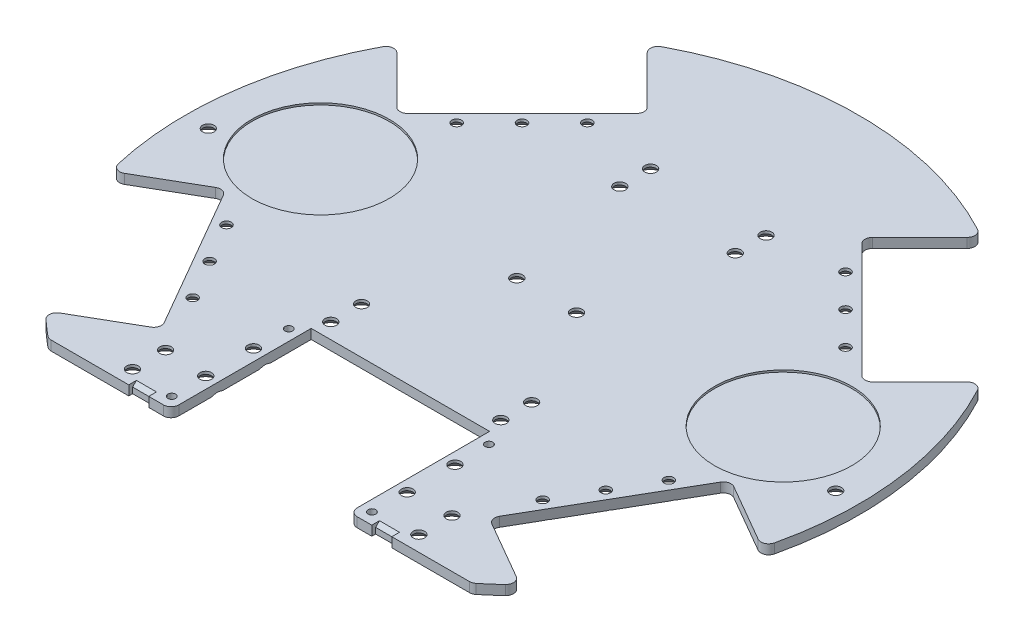
from build123d import *

# Parameters (mm, degrees)
RESSALTO_EXTRUS_O1_DEPTH = 2.5
CORTE_EXTRUS_O1_REACH    = 125.769
ESBO_O7_W                = 5.2
ESBO_O7_H                = 1
CHANFRO1_SIZE            = 1
ESBO_O10_R               = 1
ESBO_O10_R_2             = 1.25
ESBO_O10_R_3             = 1.5
CORTE_EXTRUS_O4_DEPTH    = 2.5
CHANFRO2_SIZE            = 1.8
ESBO_O11_R               = 17.85
CORTE_EXTRUS_O5_DEPTH    = 0.5


with BuildPart() as part:
    # Esboço3 → Ressalto-extrusão1 (new body)
    with BuildSketch(Plane(origin=(0, 0, 0), x_dir=(1, 0, 0), z_dir=(0, 1, 0))):
        with BuildLine():
            Line((-21.17, -31.6), (21.17, -31.6))
            Line((21.17, -31.6), (23.17, -31.6))
            Line((23.17, -31.6), (23.17, -33.6))
            Line((23.17, -33.6), (23.17, -66))
            ThreePointArc((23.17, -66), (23.755786438, -67.414213562), (25.17, -68))
            Line((25.17, -68), (54.353012796, -68))
            ThreePointArc((54.353012796, -68), (55.028394429, -67.882514183), (55.6244283, -67.543859649))
            ThreePointArc((55.6244283, -67.543859649), (57.676074894, -65.800610824), (59.673119561, -63.995068574))
            ThreePointArc((59.673119561, -63.995068574), (60.296309326, -62.30594469), (59.309162543, -60.800273342))
            Line((59.309162543, -60.800273342), (44.291990856, -52.130105226))
            ThreePointArc((44.291990856, -52.130105226), (43.360139203, -50.915692509), (43.559940048, -49.398054419))
            Line((43.559940048, -49.398054419), (64.559940048, -13.02498746))
            ThreePointArc((64.559940048, -13.02498746), (65.774352766, -12.093135807), (67.291990856, -12.292936652))
            Line((67.291990856, -12.292936652), (82.309162543, -20.963104768))
            ThreePointArc((82.309162543, -20.963104768), (84.106685572, -21.065163286), (85.257914883, -19.680903176))
            ThreePointArc((85.257914883, -19.680903176), (86.75142537, 11.421041819), (77.259029314, 41.07666478))
            ThreePointArc((77.259029314, 41.07666478), (75.78875431, 42.115797299), (74.078895082, 41.551983147))
            Line((74.078895082, 41.551983147), (61.817425744, 29.29051381))
            ThreePointArc((61.817425744, 29.29051381), (60.403212182, 28.704727372), (58.988998619, 29.29051381))
            Line((58.988998619, 29.29051381), (29.29051381, 58.988998619))
            ThreePointArc((29.29051381, 58.988998619), (28.704727372, 60.403212182), (29.29051381, 61.817425744))
            Line((29.29051381, 61.817425744), (41.551983147, 74.078895082))
            ThreePointArc((41.551983147, 74.078895082), (42.115797299, 75.78875431), (41.07666478, 77.259029314))
            ThreePointArc((41.07666478, 77.259029314), (0, 87.5), (-41.07666478, 77.259029314))
            ThreePointArc((-41.07666478, 77.259029314), (-42.115797299, 75.78875431), (-41.551983147, 74.078895082))
            Line((-41.551983147, 74.078895082), (-29.29051381, 61.817425744))
            ThreePointArc((-29.29051381, 61.817425744), (-28.704727372, 60.403212182), (-29.29051381, 58.988998619))
            Line((-29.29051381, 58.988998619), (-58.988998619, 29.29051381))
            ThreePointArc((-58.988998619, 29.29051381), (-60.403212182, 28.704727372), (-61.817425744, 29.29051381))
            Line((-61.817425744, 29.29051381), (-74.078895082, 41.551983147))
            ThreePointArc((-74.078895082, 41.551983147), (-75.78875431, 42.115797299), (-77.259029314, 41.07666478))
            ThreePointArc((-77.259029314, 41.07666478), (-86.75142537, 11.421041819), (-85.257914883, -19.680903176))
            ThreePointArc((-85.257914883, -19.680903176), (-84.106685572, -21.065163286), (-82.309162543, -20.963104768))
            Line((-82.309162543, -20.963104768), (-67.291990856, -12.292936652))
            ThreePointArc((-67.291990856, -12.292936652), (-65.774352766, -12.093135807), (-64.559940048, -13.02498746))
            Line((-64.559940048, -13.02498746), (-43.559940048, -49.398054419))
            ThreePointArc((-43.559940048, -49.398054419), (-43.360139203, -50.915692509), (-44.291990856, -52.130105226))
            Line((-44.291990856, -52.130105226), (-59.309162543, -60.800273342))
            ThreePointArc((-59.309162543, -60.800273342), (-60.296309326, -62.30594469), (-59.673119561, -63.995068574))
            ThreePointArc((-59.673119561, -63.995068574), (-57.676074894, -65.800610824), (-55.6244283, -67.543859649))
            ThreePointArc((-55.6244283, -67.543859649), (-55.028394429, -67.882514183), (-54.353012796, -68))
            Line((-54.353012796, -68), (-25.17, -68))
            ThreePointArc((-25.17, -68), (-23.755786438, -67.414213562), (-23.17, -66))
            Line((-23.17, -66), (-23.17, -33.6))
            Line((-23.17, -33.6), (-23.17, -31.6))
            Line((-23.17, -31.6), (-21.17, -31.6))
        make_face()
    extrude(amount=RESSALTO_EXTRUS_O1_DEPTH)

    # Esboço7 → Corte-extrusão1 (cut, up to next)
    with BuildSketch(Plane(origin=(0, 2.5, 0), x_dir=(1, 0, 0), z_dir=(0, 1, 0)), mode=Mode.PRIVATE) as corte_extrus_o1_sk1:
        with Locations((31.57, -67.5)):
            Rectangle(ESBO_O7_W, ESBO_O7_H)
    corte_extrus_o1_tool1 = extrude(corte_extrus_o1_sk1.sketch, amount=-CORTE_EXTRUS_O1_REACH, mode=Mode.PRIVATE) & part.part
    # Esboço7 → Corte-extrusão1 (cut, up to next)
    with BuildSketch(Plane(origin=(0, 2.5, 0), x_dir=(1, 0, 0), z_dir=(0, 1, 0)), mode=Mode.PRIVATE) as corte_extrus_o1_sk2:
        with Locations((-31.57, -67.5)):
            Rectangle(ESBO_O7_W, ESBO_O7_H)
    corte_extrus_o1_tool2 = extrude(corte_extrus_o1_sk2.sketch, amount=-CORTE_EXTRUS_O1_REACH, mode=Mode.PRIVATE) & part.part
    add(corte_extrus_o1_tool1.solids().sort_by_distance((31.57, 2.5, 67.5))[0], mode=Mode.SUBTRACT)
    add(corte_extrus_o1_tool2.solids().sort_by_distance((-31.57, 2.5, 67.5))[0], mode=Mode.SUBTRACT)

    # Chanfro1
    chanfro1_edges = [part.edges().sort_by_distance(p)[0] for p in [
        (31.57, 2.5, 67),
        (-31.57, 2.5, 67),
    ]]
    chamfer(chanfro1_edges, length=CHANFRO1_SIZE)

    # Esboço10 → Corte-extrusão4 (cut)
    with BuildSketch(Plane(origin=(0, 2.5, 0), x_dir=(1, 0, 0), z_dir=(0, 1, 0))):
        with Locations(Location((-26, -65, 0), (0, 0, 270))):
            Circle(ESBO_O10_R)
        with Locations(Location((26, -34.6, 0), (0, 0, 270))):
            Circle(ESBO_O10_R)
        with Locations(Location((-45.461863837, -40.103825785, 0), (0, 0, 270))):
            Circle(ESBO_O10_R_2)
        with Locations(Location((-51.461863837, -29.711520939, 0), (0, 0, 270))):
            Circle(ESBO_O10_R_2)
        with Locations(Location((-57.461863837, -19.319216094, 0), (0, 0, 270))):
            Circle(ESBO_O10_R_2)
        with Locations(Location((81.5, 0, 0), (0, 0, 270))):
            Circle(ESBO_O10_R_3)
        with Locations(Location((-50.503717245, 33.533154497, 0), (0, 0, 270))):
            Circle(ESBO_O10_R_2)
        with Locations(Location((-42.018435871, 42.018435871, 0), (0, 0, 270))):
            Circle(ESBO_O10_R_2)
        with Locations(Location((-33.533154497, 50.503717245, 0), (0, 0, 270))):
            Circle(ESBO_O10_R_2)
        with Locations(Location((37.2, -55.4, 0), (0, 0, 270))):
            Circle(ESBO_O10_R_3)
        with Locations(Location((37.2, -64, 0), (0, 0, 270))):
            Circle(ESBO_O10_R_3)
        with Locations(Location((26.17, -56, 0), (0, 0, 270))):
            Circle(ESBO_O10_R_3)
        with Locations(Location((26.17, -43.6, 0), (0, 0, 270))):
            Circle(ESBO_O10_R_3)
        with Locations(Location((22.09, -27.6, 0), (0, 0, 270))):
            Circle(ESBO_O10_R_3)
        with Locations(Location((22.09, -19.6, 0), (0, 0, 270))):
            Circle(ESBO_O10_R_3)
        with Locations(Location((-22.09, -19.6, 0), (0, 0, 270))):
            Circle(ESBO_O10_R_3)
        with Locations(Location((-22.09, -27.6, 0), (0, 0, 270))):
            Circle(ESBO_O10_R_3)
        with Locations(Location((-26.17, -43.6, 0), (0, 0, 270))):
            Circle(ESBO_O10_R_3)
        with Locations(Location((-26.17, -56, 0), (0, 0, 270))):
            Circle(ESBO_O10_R_3)
        with Locations(Location((-37.2, -64, 0), (0, 0, 270))):
            Circle(ESBO_O10_R_3)
        with Locations(Location((-37.2, -55.4, 0), (0, 0, 270))):
            Circle(ESBO_O10_R_3)
        with Locations(Location((33.533154497, 50.503717245, 0), (0, 0, 270))):
            Circle(ESBO_O10_R_2)
        with Locations(Location((42.018435871, 42.018435871, 0), (0, 0, 270))):
            Circle(ESBO_O10_R_2)
        with Locations(Location((50.503717245, 33.533154497, 0), (0, 0, 270))):
            Circle(ESBO_O10_R_2)
        with Locations(Location((-81.5, 0, 0), (0, 0, 270))):
            Circle(ESBO_O10_R_3)
        with Locations(Location((45.461863837, -40.103825785, 0), (0, 0, 270))):
            Circle(ESBO_O10_R_2)
        with Locations(Location((51.461863837, -29.711520939, 0), (0, 0, 270))):
            Circle(ESBO_O10_R_2)
        with Locations(Location((57.461863837, -19.319216094, 0), (0, 0, 270))):
            Circle(ESBO_O10_R_2)
        with Locations(Location((-15, 48.4, 0), (0, 0, 270))):
            Circle(ESBO_O10_R_3)
        with Locations(Location((-15, 40.4, 0), (0, 0, 270))):
            Circle(ESBO_O10_R_3)
        with Locations(Location((15, 48.4, 0), (0, 0, 270))):
            Circle(ESBO_O10_R_3)
        with Locations(Location((15, 40.4, 0), (0, 0, 270))):
            Circle(ESBO_O10_R_3)
        with Locations(Location((-7.75, 6.4, 0), (0, 0, 270))):
            Circle(ESBO_O10_R_3)
        with Locations(Location((7.75, 6.4, 0), (0, 0, 270))):
            Circle(ESBO_O10_R_3)
        with Locations(Location((26, -65, 0), (0, 0, 270))):
            Circle(ESBO_O10_R)
        with Locations(Location((-26, -34.6, 0), (0, 0, 270))):
            Circle(ESBO_O10_R)
    extrude(amount=-CORTE_EXTRUS_O4_DEPTH, mode=Mode.SUBTRACT)

    # Chanfro2
    # the kernel refuses this chamfer: 1.8 mm, written as the material it takes off along each edge
    with BuildSketch(Plane(origin=(-45.461863837, 0, 40.103825785), x_dir=(0, 0, 1), z_dir=(-1, 0, 0))) as chanfro2_piece_1:
        Polygon((1.25, CHANFRO2_SIZE), (1.25 + CHANFRO2_SIZE, 0), (1.25, 0), align=None)
    revolve(axis=Axis((-45.461863837, 0, 40.103825785), (0, 1, 0)), mode=Mode.SUBTRACT)
    with BuildSketch(Plane(origin=(-57.461863837, 0, 19.319216094), x_dir=(0, 0, 1), z_dir=(-1, 0, 0))) as chanfro2_piece_2:
        Polygon((1.25, CHANFRO2_SIZE), (1.25 + CHANFRO2_SIZE, 0), (1.25, 0), align=None)
    revolve(axis=Axis((-57.461863837, 0, 19.319216094), (0, 1, 0)), mode=Mode.SUBTRACT)
    with BuildSketch(Plane(origin=(-51.461863837, 0, 29.711520939), x_dir=(0, 0, 1), z_dir=(-1, 0, 0))) as chanfro2_piece_3:
        Polygon((1.25, CHANFRO2_SIZE), (1.25 + CHANFRO2_SIZE, 0), (1.25, 0), align=None)
    revolve(axis=Axis((-51.461863837, 0, 29.711520939), (0, 1, 0)), mode=Mode.SUBTRACT)
    with BuildSketch(Plane(origin=(81.5, 0, 0), x_dir=(0, 0, 1), z_dir=(-1, 0, 0))) as chanfro2_piece_4:
        Polygon((1.5, CHANFRO2_SIZE), (1.5 + CHANFRO2_SIZE, 0), (1.5, 0), align=None)
    revolve(axis=Axis((81.5, 0, 0), (0, 1, 0)), mode=Mode.SUBTRACT)
    with BuildSketch(Plane(origin=(-50.503717245, 0, -33.533154497), x_dir=(0, 0, 1), z_dir=(-1, 0, 0))) as chanfro2_piece_5:
        Polygon((1.25, CHANFRO2_SIZE), (1.25 + CHANFRO2_SIZE, 0), (1.25, 0), align=None)
    revolve(axis=Axis((-50.503717245, 0, -33.533154497), (0, 1, 0)), mode=Mode.SUBTRACT)
    with BuildSketch(Plane(origin=(-42.018435871, 0, -42.018435871), x_dir=(0, 0, 1), z_dir=(-1, 0, 0))) as chanfro2_piece_6:
        Polygon((1.25, CHANFRO2_SIZE), (1.25 + CHANFRO2_SIZE, 0), (1.25, 0), align=None)
    revolve(axis=Axis((-42.018435871, 0, -42.018435871), (0, 1, 0)), mode=Mode.SUBTRACT)
    with BuildSketch(Plane(origin=(-33.533154497, 0, -50.503717245), x_dir=(0, 0, 1), z_dir=(-1, 0, 0))) as chanfro2_piece_7:
        Polygon((1.25, CHANFRO2_SIZE), (1.25 + CHANFRO2_SIZE, 0), (1.25, 0), align=None)
    revolve(axis=Axis((-33.533154497, 0, -50.503717245), (0, 1, 0)), mode=Mode.SUBTRACT)
    with BuildSketch(Plane(origin=(37.2, 0, 55.4), x_dir=(0, 0, 1), z_dir=(-1, 0, 0))) as chanfro2_piece_8:
        Polygon((1.5, CHANFRO2_SIZE), (1.5 + CHANFRO2_SIZE, 0), (1.5, 0), align=None)
    revolve(axis=Axis((37.2, 0, 55.4), (0, 1, 0)), mode=Mode.SUBTRACT)
    with BuildSketch(Plane(origin=(37.2, 0, 64), x_dir=(0, 0, 1), z_dir=(-1, 0, 0))) as chanfro2_piece_9:
        Polygon((1.5, CHANFRO2_SIZE), (1.5 + CHANFRO2_SIZE, 0), (1.5, 0), align=None)
    revolve(axis=Axis((37.2, 0, 64), (0, 1, 0)), mode=Mode.SUBTRACT)
    with BuildSketch(Plane(origin=(26.17, 0, 56), x_dir=(0, 0, 1), z_dir=(-1, 0, 0))) as chanfro2_piece_10:
        Polygon((1.5, CHANFRO2_SIZE), (1.5 + CHANFRO2_SIZE, 0), (1.5, 0), align=None)
    revolve(axis=Axis((26.17, 0, 56), (0, 1, 0)), mode=Mode.SUBTRACT)
    with BuildSketch(Plane(origin=(26.17, 0, 43.6), x_dir=(0, 0, 1), z_dir=(-1, 0, 0))) as chanfro2_piece_11:
        Polygon((1.5, CHANFRO2_SIZE), (1.5 + CHANFRO2_SIZE, 0), (1.5, 0), align=None)
    revolve(axis=Axis((26.17, 0, 43.6), (0, 1, 0)), mode=Mode.SUBTRACT)
    with BuildSketch(Plane(origin=(22.09, 0, 27.6), x_dir=(0, 0, 1), z_dir=(-1, 0, 0))) as chanfro2_piece_12:
        Polygon((1.5, CHANFRO2_SIZE), (1.5 + CHANFRO2_SIZE, 0), (1.5, 0), align=None)
    revolve(axis=Axis((22.09, 0, 27.6), (0, 1, 0)), mode=Mode.SUBTRACT)
    with BuildSketch(Plane(origin=(22.09, 0, 19.6), x_dir=(0, 0, 1), z_dir=(-1, 0, 0))) as chanfro2_piece_13:
        Polygon((1.5, CHANFRO2_SIZE), (1.5 + CHANFRO2_SIZE, 0), (1.5, 0), align=None)
    revolve(axis=Axis((22.09, 0, 19.6), (0, 1, 0)), mode=Mode.SUBTRACT)
    with BuildSketch(Plane(origin=(-22.09, 0, 19.6), x_dir=(0, 0, 1), z_dir=(-1, 0, 0))) as chanfro2_piece_14:
        Polygon((1.5, CHANFRO2_SIZE), (1.5 + CHANFRO2_SIZE, 0), (1.5, 0), align=None)
    revolve(axis=Axis((-22.09, 0, 19.6), (0, 1, 0)), mode=Mode.SUBTRACT)
    with BuildSketch(Plane(origin=(-22.09, 0, 27.6), x_dir=(0, 0, 1), z_dir=(-1, 0, 0))) as chanfro2_piece_15:
        Polygon((1.5, CHANFRO2_SIZE), (1.5 + CHANFRO2_SIZE, 0), (1.5, 0), align=None)
    revolve(axis=Axis((-22.09, 0, 27.6), (0, 1, 0)), mode=Mode.SUBTRACT)
    with BuildSketch(Plane(origin=(-26.17, 0, 43.6), x_dir=(0, 0, 1), z_dir=(-1, 0, 0))) as chanfro2_piece_16:
        Polygon((1.5, CHANFRO2_SIZE), (1.5 + CHANFRO2_SIZE, 0), (1.5, 0), align=None)
    revolve(axis=Axis((-26.17, 0, 43.6), (0, 1, 0)), mode=Mode.SUBTRACT)
    with BuildSketch(Plane(origin=(-26.17, 0, 56), x_dir=(0, 0, 1), z_dir=(-1, 0, 0))) as chanfro2_piece_17:
        Polygon((1.5, CHANFRO2_SIZE), (1.5 + CHANFRO2_SIZE, 0), (1.5, 0), align=None)
    revolve(axis=Axis((-26.17, 0, 56), (0, 1, 0)), mode=Mode.SUBTRACT)
    with BuildSketch(Plane(origin=(-37.2, 0, 64), x_dir=(0, 0, 1), z_dir=(-1, 0, 0))) as chanfro2_piece_18:
        Polygon((1.5, CHANFRO2_SIZE), (1.5 + CHANFRO2_SIZE, 0), (1.5, 0), align=None)
    revolve(axis=Axis((-37.2, 0, 64), (0, 1, 0)), mode=Mode.SUBTRACT)
    with BuildSketch(Plane(origin=(-37.2, 0, 55.4), x_dir=(0, 0, 1), z_dir=(-1, 0, 0))) as chanfro2_piece_19:
        Polygon((1.5, CHANFRO2_SIZE), (1.5 + CHANFRO2_SIZE, 0), (1.5, 0), align=None)
    revolve(axis=Axis((-37.2, 0, 55.4), (0, 1, 0)), mode=Mode.SUBTRACT)
    with BuildSketch(Plane(origin=(33.533154497, 0, -50.503717245), x_dir=(0, 0, 1), z_dir=(-1, 0, 0))) as chanfro2_piece_20:
        Polygon((1.25, CHANFRO2_SIZE), (1.25 + CHANFRO2_SIZE, 0), (1.25, 0), align=None)
    revolve(axis=Axis((33.533154497, 0, -50.503717245), (0, 1, 0)), mode=Mode.SUBTRACT)
    with BuildSketch(Plane(origin=(42.018435871, 0, -42.018435871), x_dir=(0, 0, 1), z_dir=(-1, 0, 0))) as chanfro2_piece_21:
        Polygon((1.25, CHANFRO2_SIZE), (1.25 + CHANFRO2_SIZE, 0), (1.25, 0), align=None)
    revolve(axis=Axis((42.018435871, 0, -42.018435871), (0, 1, 0)), mode=Mode.SUBTRACT)
    with BuildSketch(Plane(origin=(50.503717245, 0, -33.533154497), x_dir=(0, 0, 1), z_dir=(-1, 0, 0))) as chanfro2_piece_22:
        Polygon((1.25, CHANFRO2_SIZE), (1.25 + CHANFRO2_SIZE, 0), (1.25, 0), align=None)
    revolve(axis=Axis((50.503717245, 0, -33.533154497), (0, 1, 0)), mode=Mode.SUBTRACT)
    with BuildSketch(Plane(origin=(-81.5, 0, 0), x_dir=(0, 0, 1), z_dir=(-1, 0, 0))) as chanfro2_piece_23:
        Polygon((1.5, CHANFRO2_SIZE), (1.5 + CHANFRO2_SIZE, 0), (1.5, 0), align=None)
    revolve(axis=Axis((-81.5, 0, 0), (0, 1, 0)), mode=Mode.SUBTRACT)
    with BuildSketch(Plane(origin=(45.461863837, 0, 40.103825785), x_dir=(0, 0, 1), z_dir=(-1, 0, 0))) as chanfro2_piece_24:
        Polygon((1.25, CHANFRO2_SIZE), (1.25 + CHANFRO2_SIZE, 0), (1.25, 0), align=None)
    revolve(axis=Axis((45.461863837, 0, 40.103825785), (0, 1, 0)), mode=Mode.SUBTRACT)
    with BuildSketch(Plane(origin=(51.461863837, 0, 29.711520939), x_dir=(0, 0, 1), z_dir=(-1, 0, 0))) as chanfro2_piece_25:
        Polygon((1.25, CHANFRO2_SIZE), (1.25 + CHANFRO2_SIZE, 0), (1.25, 0), align=None)
    revolve(axis=Axis((51.461863837, 0, 29.711520939), (0, 1, 0)), mode=Mode.SUBTRACT)
    with BuildSketch(Plane(origin=(57.461863837, 0, 19.319216094), x_dir=(0, 0, 1), z_dir=(-1, 0, 0))) as chanfro2_piece_26:
        Polygon((1.25, CHANFRO2_SIZE), (1.25 + CHANFRO2_SIZE, 0), (1.25, 0), align=None)
    revolve(axis=Axis((57.461863837, 0, 19.319216094), (0, 1, 0)), mode=Mode.SUBTRACT)
    with BuildSketch(Plane(origin=(-15, 0, -48.4), x_dir=(0, 0, 1), z_dir=(-1, 0, 0))) as chanfro2_piece_27:
        Polygon((1.5, CHANFRO2_SIZE), (1.5 + CHANFRO2_SIZE, 0), (1.5, 0), align=None)
    revolve(axis=Axis((-15, 0, -48.4), (0, 1, 0)), mode=Mode.SUBTRACT)
    with BuildSketch(Plane(origin=(-15, 0, -40.4), x_dir=(0, 0, 1), z_dir=(-1, 0, 0))) as chanfro2_piece_28:
        Polygon((1.5, CHANFRO2_SIZE), (1.5 + CHANFRO2_SIZE, 0), (1.5, 0), align=None)
    revolve(axis=Axis((-15, 0, -40.4), (0, 1, 0)), mode=Mode.SUBTRACT)
    with BuildSketch(Plane(origin=(15, 0, -48.4), x_dir=(0, 0, 1), z_dir=(-1, 0, 0))) as chanfro2_piece_29:
        Polygon((1.5, CHANFRO2_SIZE), (1.5 + CHANFRO2_SIZE, 0), (1.5, 0), align=None)
    revolve(axis=Axis((15, 0, -48.4), (0, 1, 0)), mode=Mode.SUBTRACT)
    with BuildSketch(Plane(origin=(15, 0, -40.4), x_dir=(0, 0, 1), z_dir=(-1, 0, 0))) as chanfro2_piece_30:
        Polygon((1.5, CHANFRO2_SIZE), (1.5 + CHANFRO2_SIZE, 0), (1.5, 0), align=None)
    revolve(axis=Axis((15, 0, -40.4), (0, 1, 0)), mode=Mode.SUBTRACT)
    with BuildSketch(Plane(origin=(-7.75, 0, -6.4), x_dir=(0, 0, 1), z_dir=(-1, 0, 0))) as chanfro2_piece_31:
        Polygon((1.5, CHANFRO2_SIZE), (1.5 + CHANFRO2_SIZE, 0), (1.5, 0), align=None)
    revolve(axis=Axis((-7.75, 0, -6.4), (0, 1, 0)), mode=Mode.SUBTRACT)
    with BuildSketch(Plane(origin=(7.75, 0, -6.4), x_dir=(0, 0, 1), z_dir=(-1, 0, 0))) as chanfro2_piece_32:
        Polygon((1.5, CHANFRO2_SIZE), (1.5 + CHANFRO2_SIZE, 0), (1.5, 0), align=None)
    revolve(axis=Axis((7.75, 0, -6.4), (0, 1, 0)), mode=Mode.SUBTRACT)

    # Esboço11 → Corte-extrusão5 (cut)
    with BuildSketch(Plane(origin=(0, 2.5, 0), x_dir=(1, 0, 0), z_dir=(0, 1, 0))):
        with Locations(Location((-60.096537735, 7.751346883, 0), (0, 0, 270))):
            Circle(ESBO_O11_R)
        with Locations(Location((60.096537735, 7.751346883, 0), (0, 0, 270))):
            Circle(ESBO_O11_R)
    extrude(amount=-CORTE_EXTRUS_O5_DEPTH, mode=Mode.SUBTRACT)


solid = part.part
